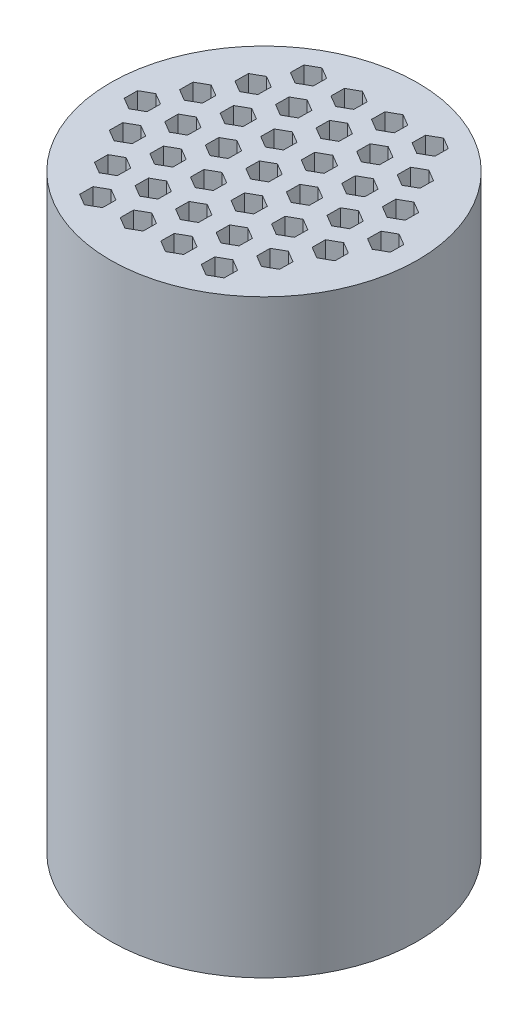
from build123d import *

# Parameters (mm, degrees)
SKETCH1_R           = 1.25
BOSS_EXTRUDE1_DEPTH = 4.8
CUT_EXTRUDE1_DEPTH  = 6.115173506
FILL_PATTERN1_DEPTH = 4.8


# Read off the part's stored shape, not the designer's step: Fill Pattern1
with BuildPart() as part:
    # Sketch1 → Boss-Extrude1 (new body)
    with BuildSketch(Plane(origin=(0, 0, 0), x_dir=(1, 0, 0), z_dir=(0, 1, 0))):
        with Locations(Location((0, 0, 0), (0, 0, 270))):
            Circle(SKETCH1_R)
    extrude(amount=BOSS_EXTRUDE1_DEPTH)

    # Sketch2 → Cut-Extrude1 (cut, through all)
    with BuildSketch(Plane(origin=(0, 0, 0), x_dir=(1, 0, 0), z_dir=(0, 1, 0))):
        Polygon((-0.094346036, -0.053201754), (-0.001098947, -0.108306941), (0.093247088, -0.055105187), (0.094346036, 0.053201754), (0.001098947, 0.108306941), (-0.093247088, 0.055105187), align=None)
    extrude(amount=CUT_EXTRUDE1_DEPTH, mode=Mode.SUBTRACT)

    # Fill Pattern1 outline → Fill Pattern1 (cut)
    with BuildSketch(Plane(origin=(0, 0, 0), x_dir=(1, 0, 0), z_dir=(0, 1, 0))):
        Polygon((-1.083247088, 0.055105187), (-1.084346036, -0.053201754), (-0.991098947, -0.108306941), (-0.896752912, -0.055105187), (-0.895653964, 0.053201754), (-0.988901053, 0.108306941), align=None)
        Polygon((-0.753247088, 0.626681953), (-0.754346036, 0.518375012), (-0.661098947, 0.463269826), (-0.566752912, 0.51647158), (-0.565653964, 0.624778521), (-0.658901053, 0.679883707), align=None)
        Polygon((-0.588247088, 0.34089357), (-0.589346036, 0.232586629), (-0.496098947, 0.177481443), (-0.401752912, 0.230683197), (-0.400653964, 0.338990137), (-0.493901053, 0.394095324), align=None)
        Polygon((-0.423247088, 0.055105187), (-0.424346036, -0.053201754), (-0.331098947, -0.108306941), (-0.236752912, -0.055105187), (-0.235653964, 0.053201754), (-0.328901053, 0.108306941), align=None)
        Polygon((-0.258247088, -0.230683197), (-0.259346036, -0.338990137), (-0.166098947, -0.394095324), (-0.071752912, -0.34089357), (-0.070653964, -0.232586629), (-0.163901053, -0.177481443), align=None)
        Polygon((-0.093247088, -0.51647158), (-0.094346036, -0.624778521), (-0.001098947, -0.679883707), (0.093247088, -0.626681953), (0.094346036, -0.518375012), (0.001098947, -0.463269826), align=None)
        Polygon((0.071752912, -0.802259963), (0.070653964, -0.910566904), (0.163901053, -0.96567209), (0.258247088, -0.912470336), (0.259346036, -0.804163396), (0.166098947, -0.749058209), align=None)
        Polygon((-0.588247088, 0.912470336), (-0.589346036, 0.804163396), (-0.496098947, 0.749058209), (-0.401752912, 0.802259963), (-0.400653964, 0.910566904), (-0.493901053, 0.96567209), align=None)
        Polygon((-0.423247088, 0.626681953), (-0.424346036, 0.518375012), (-0.331098947, 0.463269826), (-0.236752912, 0.51647158), (-0.235653964, 0.624778521), (-0.328901053, 0.679883707), align=None)
        Polygon((-0.258247088, 0.34089357), (-0.259346036, 0.232586629), (-0.166098947, 0.177481443), (-0.071752912, 0.230683197), (-0.070653964, 0.338990137), (-0.163901053, 0.394095324), align=None)
        Polygon((-0.918247088, 0.34089357), (-0.919346036, 0.232586629), (-0.826098947, 0.177481443), (-0.731752912, 0.230683197), (-0.730653964, 0.338990137), (-0.823901053, 0.394095324), align=None)
        Polygon((-0.588247088, -0.802259963), (-0.589346036, -0.910566904), (-0.496098947, -0.96567209), (-0.401752912, -0.912470336), (-0.400653964, -0.804163396), (-0.493901053, -0.749058209), align=None)
        Polygon((-0.753247088, -0.51647158), (-0.754346036, -0.624778521), (-0.661098947, -0.679883707), (-0.566752912, -0.626681953), (-0.565653964, -0.518375012), (-0.658901053, -0.463269826), align=None)
        Polygon((-0.918247088, -0.230683197), (-0.919346036, -0.338990137), (-0.826098947, -0.394095324), (-0.731752912, -0.34089357), (-0.730653964, -0.232586629), (-0.823901053, -0.177481443), align=None)
        Polygon((-0.753247088, 0.055105187), (-0.754346036, -0.053201754), (-0.661098947, -0.108306941), (-0.566752912, -0.055105187), (-0.565653964, 0.053201754), (-0.658901053, 0.108306941), align=None)
        Polygon((-0.588247088, -0.230683197), (-0.589346036, -0.338990137), (-0.496098947, -0.394095324), (-0.401752912, -0.34089357), (-0.400653964, -0.232586629), (-0.493901053, -0.177481443), align=None)
        Polygon((-0.423247088, -0.51647158), (-0.424346036, -0.624778521), (-0.331098947, -0.679883707), (-0.236752912, -0.626681953), (-0.235653964, -0.518375012), (-0.328901053, -0.463269826), align=None)
        Polygon((-0.258247088, -0.802259963), (-0.259346036, -0.910566904), (-0.166098947, -0.96567209), (-0.071752912, -0.912470336), (-0.070653964, -0.804163396), (-0.163901053, -0.749058209), align=None)
        Polygon((0.071752912, 0.912470336), (0.070653964, 0.804163396), (0.163901053, 0.749058209), (0.258247088, 0.802259963), (0.259346036, 0.910566904), (0.166098947, 0.96567209), align=None)
        Polygon((0.236752912, 0.626681953), (0.235653964, 0.518375012), (0.328901053, 0.463269826), (0.423247088, 0.51647158), (0.424346036, 0.624778521), (0.331098947, 0.679883707), align=None)
        Polygon((0.401752912, 0.34089357), (0.400653964, 0.232586629), (0.493901053, 0.177481443), (0.588247088, 0.230683197), (0.589346036, 0.338990137), (0.496098947, 0.394095324), align=None)
        Polygon((0.566752912, 0.055105187), (0.565653964, -0.053201754), (0.658901053, -0.108306941), (0.753247088, -0.055105187), (0.754346036, 0.053201754), (0.661098947, 0.108306941), align=None)
        Polygon((0.896752912, 0.055105187), (0.895653964, -0.053201754), (0.988901053, -0.108306941), (1.083247088, -0.055105187), (1.084346036, 0.053201754), (0.991098947, 0.108306941), align=None)
        Polygon((0.731752912, 0.34089357), (0.730653964, 0.232586629), (0.823901053, 0.177481443), (0.918247088, 0.230683197), (0.919346036, 0.338990137), (0.826098947, 0.394095324), align=None)
        Polygon((0.566752912, 0.626681953), (0.565653964, 0.518375012), (0.658901053, 0.463269826), (0.753247088, 0.51647158), (0.754346036, 0.624778521), (0.661098947, 0.679883707), align=None)
        Polygon((0.401752912, 0.912470336), (0.400653964, 0.804163396), (0.493901053, 0.749058209), (0.588247088, 0.802259963), (0.589346036, 0.910566904), (0.496098947, 0.96567209), align=None)
        Polygon((0.731752912, -0.230683197), (0.730653964, -0.338990137), (0.823901053, -0.394095324), (0.918247088, -0.34089357), (0.919346036, -0.232586629), (0.826098947, -0.177481443), align=None)
        Polygon((-0.258247088, 0.912470336), (-0.259346036, 0.804163396), (-0.166098947, 0.749058209), (-0.071752912, 0.802259963), (-0.070653964, 0.910566904), (-0.163901053, 0.96567209), align=None)
        Polygon((0.401752912, -0.802259963), (0.400653964, -0.910566904), (0.493901053, -0.96567209), (0.588247088, -0.912470336), (0.589346036, -0.804163396), (0.496098947, -0.749058209), align=None)
        Polygon((0.236752912, -0.51647158), (0.235653964, -0.624778521), (0.328901053, -0.679883707), (0.423247088, -0.626681953), (0.424346036, -0.518375012), (0.331098947, -0.463269826), align=None)
        Polygon((0.071752912, -0.230683197), (0.070653964, -0.338990137), (0.163901053, -0.394095324), (0.258247088, -0.34089357), (0.259346036, -0.232586629), (0.166098947, -0.177481443), align=None)
        Polygon((-0.093247088, 0.626681953), (-0.094346036, 0.518375012), (-0.001098947, 0.463269826), (0.093247088, 0.51647158), (0.094346036, 0.624778521), (0.001098947, 0.679883707), align=None)
        Polygon((0.071752912, 0.34089357), (0.070653964, 0.232586629), (0.163901053, 0.177481443), (0.258247088, 0.230683197), (0.259346036, 0.338990137), (0.166098947, 0.394095324), align=None)
        Polygon((0.236752912, 0.055105187), (0.235653964, -0.053201754), (0.328901053, -0.108306941), (0.423247088, -0.055105187), (0.424346036, 0.053201754), (0.331098947, 0.108306941), align=None)
        Polygon((0.401752912, -0.230683197), (0.400653964, -0.338990137), (0.493901053, -0.394095324), (0.588247088, -0.34089357), (0.589346036, -0.232586629), (0.496098947, -0.177481443), align=None)
        Polygon((0.566752912, -0.51647158), (0.565653964, -0.624778521), (0.658901053, -0.679883707), (0.753247088, -0.626681953), (0.754346036, -0.518375012), (0.661098947, -0.463269826), align=None)
    extrude(amount=FILL_PATTERN1_DEPTH, mode=Mode.SUBTRACT)


solid = part.part
